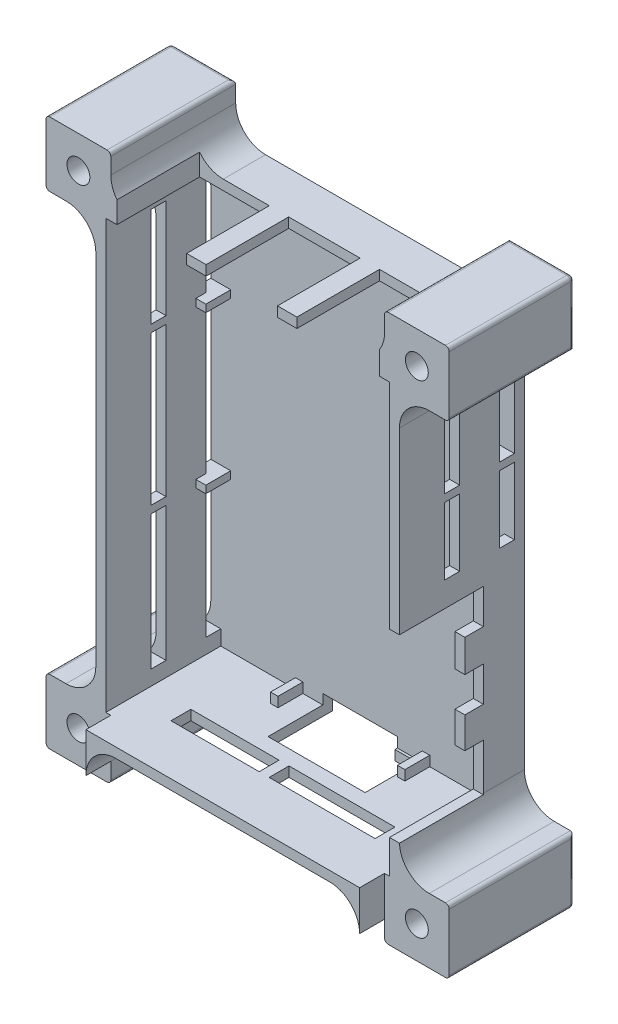
from build123d import *

# Parameters (mm, degrees)
SKETCH1_W            = 61
SKETCH1_H            = 90
BOSS_EXTRUDE1_DEPTH  = 2
SKETCH2_W            = 61
SKETCH2_H            = 90
SKETCH2_W_2          = 57
SKETCH2_H_2          = 86
BOSS_EXTRUDE2_DEPTH  = 6.6
SKETCH3_W            = 1.5
SKETCH3_H            = 2
SKETCH3_W_2          = 2
SKETCH3_H_2          = 1.5
BOSS_EXTRUDE3_DEPTH  = 5
SKETCH4_W            = 61
SKETCH4_H            = 90
SKETCH4_W_2          = 57
SKETCH4_H_2          = 86
BOSS_EXTRUDE4_DEPTH  = 16.5
SKETCH5_W            = 14.35
SKETCH5_H            = 16.6
SKETCH5_W_2          = 14
CUT_EXTRUDE1_DEPTH   = 2
SKETCH7_W            = 3
SKETCH7_H            = 35
SKETCH7_H_2          = 13.5
SKETCH7_H_3          = 20
CUT_EXTRUDE2_DEPTH   = 2
SKETCH8_W            = 19.5
SKETCH8_H            = 10.5
SKETCH8_W_2          = 17.719958389
SKETCH8_H_2          = 4
SKETCH8_W_3          = 21.280041611
CUT_EXTRUDE3_DEPTH   = 2
SKETCH9_W            = 3
SKETCH9_H            = 80
SKETCH9_H_2          = 20
SKETCH9_H_3          = 30
SKETCH9_H_4          = 27
CUT_EXTRUDE4_DEPTH   = 2
SKETCH10_W           = 61
SKETCH10_H           = 2
BOSS_EXTRUDE5_DEPTH  = 5
SKETCH12_W           = 3
SKETCH12_H           = 1.5
BOSS_EXTRUDE6_DEPTH  = 2
SKETCH13_W           = 3
SKETCH13_H           = 1.5
BOSS_EXTRUDE7_DEPTH  = 2
SKETCH20_W           = 13
SKETCH20_H           = 13
BOSS_EXTRUDE8_DEPTH  = 25.1
SKETCH25_W           = 13
SKETCH25_H           = 13
SKETCH25_W_2         = 0.25
CUT_EXTRUDE11_DEPTH  = 126.183904716
SKETCH26_W           = 1
SKETCH26_H           = 1
CUT_EXTRUDE12_DEPTH  = 23.1
SKETCH27_R           = 2.3
CUT_EXTRUDE13_DEPTH  = 126.183904716
CUT_EXTRUDE17_DEPTH  = 6
FILLET3_R            = 6
FILLET4_R            = 6
SKETCH33_W           = 0.250000008
SKETCH33_H           = 2
BOSS_EXTRUDE10_DEPTH = 5
FILLET7_R            = 6
FILLET8_R            = 6
BOSS_EXTRUDE11_DEPTH = 25.1
SKETCH35_R           = 2.3
CUT_EXTRUDE18_DEPTH  = 126.183904716
FILLET9_R            = 6
FILLET10_R           = 6
FILLET11_R           = 6
FILLET13_R           = 0.75
CUT_EXTRUDE19_DEPTH  = 6
SKETCH38_W           = 11
SKETCH38_H           = 11
CUT_EXTRUDE20_DEPTH  = 10
FILLET14_R           = 6
SKETCH39_W           = 15
SKETCH39_H           = 2.5
CUT_EXTRUDE21_DEPTH  = 4


with BuildPart() as part:
    # Sketch1 → Boss-Extrude1 (new body)
    with BuildSketch(Plane.XY):
        with Locations((30.5, 45)):
            Rectangle(SKETCH1_W, SKETCH1_H)
    extrude(amount=BOSS_EXTRUDE1_DEPTH)

    # Sketch2 → Boss-Extrude2 (add)
    with BuildSketch(Plane.XY.offset(2)):
        with Locations((30.5, 45)):
            Rectangle(SKETCH2_W, SKETCH2_H)
        with Locations((30.5, 45)):
            Rectangle(SKETCH2_W_2, SKETCH2_H_2, mode=Mode.SUBTRACT)
    extrude(amount=BOSS_EXTRUDE2_DEPTH)

    # Sketch3 → Boss-Extrude3 (add)
    with BuildSketch(Plane.XY.offset(2)):
        with Locations((43.25, 3)):
            Rectangle(SKETCH3_W, SKETCH3_H)
        with Locations((17.75, 3)):
            Rectangle(SKETCH3_W, SKETCH3_H)
        with Locations((3, 32.75)):
            Rectangle(SKETCH3_W_2, SKETCH3_H_2)
        with Locations((58, 32.75)):
            Rectangle(SKETCH3_W_2, SKETCH3_H_2)
        with Locations((58, 64.25)):
            Rectangle(SKETCH3_W_2, SKETCH3_H_2)
        with Locations((3, 64.25)):
            Rectangle(SKETCH3_W_2, SKETCH3_H_2)
    extrude(amount=BOSS_EXTRUDE3_DEPTH)

    # Sketch4 → Boss-Extrude4 (add)
    with BuildSketch(Plane.XY.offset(8.6)):
        with Locations((30.5, 45)):
            Rectangle(SKETCH4_W, SKETCH4_H)
        with Locations((30.5, 45)):
            Rectangle(SKETCH4_W_2, SKETCH4_H_2, mode=Mode.SUBTRACT)
    extrude(amount=BOSS_EXTRUDE4_DEPTH)

    # Sketch5 → Cut-Extrude1 (cut)
    with BuildSketch(Plane(origin=(0, 90, 0), x_dir=(1, 0, 0), z_dir=(0, 1, 0))):
        Polygon((57, -8.5), (40.4, -8.5), (40.4, -22.25), (40.4, -25.1), (57, -25.1), align=None)
        with Locations((29.325, -16.8)):
            Rectangle(SKETCH5_W, SKETCH5_H)
        with Locations((11.25, -16.8)):
            Rectangle(SKETCH5_W_2, SKETCH5_H)
    extrude(amount=-CUT_EXTRUDE1_DEPTH, mode=Mode.SUBTRACT)

    # Sketch7 → Cut-Extrude2 (cut)
    with BuildSketch(Plane(origin=(61, 0, 0), x_dir=(0, 0, -1), z_dir=(1, 0, 0))):
        Polygon((-11.95, 18.25), (-11.95, 24.5), (-8.25, 24.5), (-8.25, 31.5), (-11.95, 31.5), (-11.95, 38), (-8.25, 38), (-8.25, 45), (-25.1, 45), (-25.1, 8.75), (-8.25, 8.75), (-8.25, 18.25), align=None)
        with Locations((-3.5, 67.5)):
            Rectangle(SKETCH7_W, SKETCH7_H)
        with Locations((-14.5, 56.75)):
            Rectangle(SKETCH7_W, SKETCH7_H_2)
        with Locations((-14.5, 75)):
            Rectangle(SKETCH7_W, SKETCH7_H_3)
    extrude(amount=-CUT_EXTRUDE2_DEPTH, mode=Mode.SUBTRACT)

    # Sketch8 → Cut-Extrude3 (cut)
    with BuildSketch(Plane(origin=(0, 0, 0), x_dir=(-1, 0, 0), z_dir=(0, -1, 0))):
        with Locations((-32.25, -7.75)):
            Rectangle(SKETCH8_W, SKETCH8_H)
        with Locations((-18.859979194, -18)):
            Rectangle(SKETCH8_W_2, SKETCH8_H_2)
        with Locations((-40.359979194, -18)):
            Rectangle(SKETCH8_W_3, SKETCH8_H_2)
    extrude(amount=-CUT_EXTRUDE3_DEPTH, mode=Mode.SUBTRACT)

    # Sketch9 → Cut-Extrude4 (cut)
    with BuildSketch(Plane.ZY):
        with Locations((3.5, 45)):
            Rectangle(SKETCH9_W, SKETCH9_H)
        with Locations((14.5, 75)):
            Rectangle(SKETCH9_W, SKETCH9_H_2)
        with Locations((14.5, 48.5)):
            Rectangle(SKETCH9_W, SKETCH9_H_3)
        with Locations((14.5, 18.5)):
            Rectangle(SKETCH9_W, SKETCH9_H_4)
    extrude(amount=-CUT_EXTRUDE4_DEPTH, mode=Mode.SUBTRACT)

    # Sketch10 → Boss-Extrude5 (add)
    with BuildSketch(Plane.XY.offset(25.1)):
        with Locations((30.5, 1)):
            Rectangle(SKETCH10_W, SKETCH10_H)
    extrude(amount=BOSS_EXTRUDE5_DEPTH)

    # Sketch12 → Boss-Extrude6 (add)
    with BuildSketch(Plane.ZY.offset(-2)):
        with Locations((3.5, 64.25)):
            Rectangle(SKETCH12_W, SKETCH12_H)
        with Locations((3.5, 32.75)):
            Rectangle(SKETCH12_W, SKETCH12_H)
    extrude(amount=BOSS_EXTRUDE6_DEPTH)

    # Sketch13 → Boss-Extrude7 (add)
    with BuildSketch(Plane(origin=(59, 0, 0), x_dir=(0, 0, -1), z_dir=(1, 0, 0))):
        with Locations((-3.5, 64.25)):
            Rectangle(SKETCH13_W, SKETCH13_H)
    extrude(amount=BOSS_EXTRUDE7_DEPTH)

    # Sketch20 → Boss-Extrude8 (add)
    with BuildSketch(Plane(origin=(0, 0, 0), x_dir=(-1, 0, 0), z_dir=(0, 0, -1))):
        with Locations((3.5, -3.5)):
            Rectangle(SKETCH20_W, SKETCH20_H)
        with Locations((-64.5, 93.5)):
            Rectangle(SKETCH20_W, SKETCH20_H)
    extrude(amount=-BOSS_EXTRUDE8_DEPTH)

    # Sketch25 → Cut-Extrude11 (cut, through all)
    with BuildSketch(Plane.XY.offset(25.1)):
        with Locations((-3.5, -3.5)):
            Rectangle(SKETCH25_W, SKETCH25_H)
        with Locations((3.125, -3.5)):
            Rectangle(SKETCH25_W_2, SKETCH25_H)
    extrude(amount=CUT_EXTRUDE11_DEPTH, mode=Mode.SUBTRACT)

    # Sketch26 → Cut-Extrude12 (cut)
    with BuildSketch(Plane.XY.offset(25.1)):
        with Locations((2.5, 2.5)):
            Rectangle(SKETCH26_W, SKETCH26_H)
        with Locations((58.5, 87.5)):
            Rectangle(SKETCH26_W, SKETCH26_H)
    extrude(amount=-CUT_EXTRUDE12_DEPTH, mode=Mode.SUBTRACT)

    # Sketch27 → Cut-Extrude13 (cut, through all)
    with BuildSketch(Plane.XY.offset(25.1)):
        with Locations((-3.5, -3.5)):
            Circle(SKETCH27_R)
        with Locations((64.5, 93.5)):
            Circle(SKETCH27_R)
    extrude(amount=-CUT_EXTRUDE13_DEPTH, mode=Mode.SUBTRACT)

    # Sketch31 → Cut-Extrude17 (cut)
    with BuildSketch(Plane(origin=(0, 0, 0), x_dir=(-1, 0, 0), z_dir=(0, 0, -1))):
        Polygon((-61.873056275, 88.95), (-59.24611255, 93.5), (-61.873056275, 98.05), (-67.126943725, 98.05), (-69.75388745, 93.5), (-67.126943725, 88.95), align=None)
        Polygon((6.126943725, -8.05), (8.75388745, -3.5), (6.126943725, 1.05), (0.873056275, 1.05), (-1.75388745, -3.5), (0.873056275, -8.05), align=None)
    extrude(amount=-CUT_EXTRUDE17_DEPTH, mode=Mode.SUBTRACT)

    # Fillet3
    fillet3_edges = [part.edges().sort_by_distance(p)[0] for p in [
        (58, 90, 12.55),
    ]]
    fillet(fillet3_edges, radius=FILLET3_R)

    # Fillet4
    # the kernel refuses this fillet: 6 mm, written as the material it adds along each edge
    with BuildSketch(Plane(origin=(61, 87, 25.1), x_dir=(1, 0, 0), z_dir=(0, 0, -1))) as fillet4_piece_1_section:
        with BuildLine():
            CenterArc((FILLET4_R, FILLET4_R), FILLET4_R, 180, 90)
            Line((0, FILLET4_R), (0, 0))
            Line((0, 0), (FILLET4_R, 0))
        make_face()
    fillet4_piece_1 = extrude(amount=25.1, mode=Mode.PRIVATE)
    fillet4_piece_1 = split(fillet4_piece_1, bisect_by=Plane(origin=(62.635972967, 85, 20.55), z_dir=(0, 1, 0)), keep=Keep.TOP, mode=Mode.PRIVATE)
    add(fillet4_piece_1)
    with BuildSketch(Plane(origin=(61, 87, 25.1), x_dir=(1, 0, 0), z_dir=(0, 0, -1))) as fillet4_piece_2_section:
        with BuildLine():
            CenterArc((FILLET4_R, FILLET4_R), FILLET4_R, 180, 90)
            Line((0, FILLET4_R), (0, 0))
            Line((0, 0), (FILLET4_R, 0))
        make_face()
    fillet4_piece_2 = extrude(amount=40.1, mode=Mode.PRIVATE)
    fillet4_piece_2 = split(fillet4_piece_2, bisect_by=Plane(origin=(61.446267567, 84.027256087, 16), z_dir=(0, 0, 1)), keep=Keep.TOP, mode=Mode.PRIVATE)
    add(fillet4_piece_2)
    with BuildSketch(Plane(origin=(61, 87, 40.1), x_dir=(1, 0, 0), z_dir=(0, 0, -1))) as fillet4_piece_3_section:
        with BuildLine():
            CenterArc((FILLET4_R, FILLET4_R), FILLET4_R, 180, 90)
            Line((0, FILLET4_R), (0, 0))
            Line((0, 0), (FILLET4_R, 0))
        make_face()
    fillet4_piece_3 = extrude(amount=55.1, mode=Mode.PRIVATE)
    fillet4_piece_3 = split(fillet4_piece_3, bisect_by=Plane(origin=(61.446267567, 84.027256087, 13), z_dir=(0, 0, -1)), keep=Keep.TOP, mode=Mode.PRIVATE)
    fillet4_piece_3 = split(fillet4_piece_3, bisect_by=Plane(origin=(61.446267567, 84.027256087, 5), z_dir=(0, 0, 1)), keep=Keep.TOP, mode=Mode.PRIVATE)
    add(fillet4_piece_3)
    with BuildSketch(Plane(origin=(61, 87, 40.1), x_dir=(1, 0, 0), z_dir=(0, 0, -1))) as fillet4_piece_4_section:
        with BuildLine():
            CenterArc((FILLET4_R, FILLET4_R), FILLET4_R, 180, 90)
            Line((0, FILLET4_R), (0, 0))
            Line((0, 0), (FILLET4_R, 0))
        make_face()
    fillet4_piece_4 = extrude(amount=40.1, mode=Mode.PRIVATE)
    fillet4_piece_4 = split(fillet4_piece_4, bisect_by=Plane(origin=(61.446267567, 84.027256087, 2), z_dir=(0, 0, -1)), keep=Keep.TOP, mode=Mode.PRIVATE)
    add(fillet4_piece_4)

    # Sketch33 → Boss-Extrude10 (add)
    with BuildSketch(Plane.XY.offset(25.1)):
        with Locations((3.124999996, 1)):
            Rectangle(SKETCH33_W, SKETCH33_H)
    extrude(amount=BOSS_EXTRUDE10_DEPTH)

    # Fillet7
    # the kernel refuses this fillet: 6 mm, written as the material it adds along each edge
    with BuildSketch(Plane(origin=(3, 0, 0), x_dir=(1, 0, 0), z_dir=(0, 0, 1))) as fillet7_piece_1_section:
        with BuildLine():
            CenterArc((FILLET7_R, -FILLET7_R), FILLET7_R, 90, 90)
            Line((0, -FILLET7_R), (0, 0))
            Line((0, 0), (FILLET7_R, 0))
        make_face()
    fillet7_piece_1 = extrude(amount=25.1, mode=Mode.PRIVATE)
    fillet7_piece_1 = split(fillet7_piece_1, bisect_by=Plane(origin=(2.999999992, -1.220838783, 12.55), z_dir=(1, 0, 0)), keep=Keep.TOP, mode=Mode.PRIVATE)
    add(fillet7_piece_1)
    with BuildSketch(Plane(origin=(3, 0, 0), x_dir=(1, 0, 0), z_dir=(0, 0, 1))) as fillet7_piece_2_section:
        with BuildLine():
            CenterArc((FILLET7_R, -FILLET7_R), FILLET7_R, 90, 90)
            Line((0, -FILLET7_R), (0, 0))
            Line((0, 0), (FILLET7_R, 0))
        make_face()
    fillet7_piece_2 = extrude(amount=40.1, mode=Mode.PRIVATE)
    fillet7_piece_2 = split(fillet7_piece_2, bisect_by=Plane(origin=(4.481706294, -1.220838783, 25.1), z_dir=(0, 0, 1)), keep=Keep.TOP, mode=Mode.PRIVATE)
    fillet7_piece_2 = split(fillet7_piece_2, bisect_by=Plane(origin=(2.999999992, -1.220838783, 27.6), z_dir=(1, 0, 0)), keep=Keep.TOP, mode=Mode.PRIVATE)
    fillet7_piece_2 = split(fillet7_piece_2, bisect_by=Plane(origin=(4.481706294, -1.220838783, 30.1), z_dir=(0, 0, -1)), keep=Keep.TOP, mode=Mode.PRIVATE)
    add(fillet7_piece_2)

    # Fillet8
    # the kernel refuses this fillet: 6 mm, written as the material it adds along each edge
    with BuildSketch(Plane(origin=(0, 3, 25.1), x_dir=(0, 1, 0), z_dir=(0, 0, -1))) as fillet8_piece_1_section:
        with BuildLine():
            CenterArc((FILLET8_R, -FILLET8_R), FILLET8_R, 90, 90)
            Line((0, -FILLET8_R), (0, 0))
            Line((0, 0), (FILLET8_R, 0))
        make_face()
    fillet8_piece_1 = extrude(amount=40.1, mode=Mode.PRIVATE)
    fillet8_piece_1 = split(fillet8_piece_1, bisect_by=Plane(origin=(-0.446267567, 5.972743913, 16), z_dir=(0, 0, 1)), keep=Keep.TOP, mode=Mode.PRIVATE)
    add(fillet8_piece_1)
    with BuildSketch(Plane(origin=(0, 3, 25.1), x_dir=(0, 1, 0), z_dir=(0, 0, -1))) as fillet8_piece_2_section:
        with BuildLine():
            CenterArc((FILLET8_R, -FILLET8_R), FILLET8_R, 90, 90)
            Line((0, -FILLET8_R), (0, 0))
            Line((0, 0), (FILLET8_R, 0))
        make_face()
    fillet8_piece_2 = extrude(amount=25.1, mode=Mode.PRIVATE)
    fillet8_piece_2 = split(fillet8_piece_2, bisect_by=Plane(origin=(-1.635972967, 5, 14.5), z_dir=(0, -1, 0)), keep=Keep.TOP, mode=Mode.PRIVATE)
    add(fillet8_piece_2)
    with BuildSketch(Plane(origin=(0, 3, 40.1), x_dir=(0, 1, 0), z_dir=(0, 0, -1))) as fillet8_piece_3_section:
        with BuildLine():
            CenterArc((FILLET8_R, -FILLET8_R), FILLET8_R, 90, 90)
            Line((0, -FILLET8_R), (0, 0))
            Line((0, 0), (FILLET8_R, 0))
        make_face()
    fillet8_piece_3 = extrude(amount=55.1, mode=Mode.PRIVATE)
    fillet8_piece_3 = split(fillet8_piece_3, bisect_by=Plane(origin=(-0.446267567, 5.972743913, 13), z_dir=(0, 0, -1)), keep=Keep.TOP, mode=Mode.PRIVATE)
    fillet8_piece_3 = split(fillet8_piece_3, bisect_by=Plane(origin=(-0.446267567, 5.972743913, 5), z_dir=(0, 0, 1)), keep=Keep.TOP, mode=Mode.PRIVATE)
    add(fillet8_piece_3)
    with BuildSketch(Plane(origin=(0, 3, 40.1), x_dir=(0, 1, 0), z_dir=(0, 0, -1))) as fillet8_piece_4_section:
        with BuildLine():
            CenterArc((FILLET8_R, -FILLET8_R), FILLET8_R, 90, 90)
            Line((0, -FILLET8_R), (0, 0))
            Line((0, 0), (FILLET8_R, 0))
        make_face()
    fillet8_piece_4 = extrude(amount=40.1, mode=Mode.PRIVATE)
    fillet8_piece_4 = split(fillet8_piece_4, bisect_by=Plane(origin=(-0.446267567, 5.972743913, 2), z_dir=(0, 0, -1)), keep=Keep.TOP, mode=Mode.PRIVATE)
    add(fillet8_piece_4)

    # Sketch34 → Boss-Extrude11 (add)
    with BuildSketch(Plane.XY.offset(25.1)):
        Polygon((59, 3), (71, 3), (71, -10), (58, -10), (58, 2), (59, 2), align=None)
        Polygon((2, 87), (-10, 87), (-10, 100), (3, 100), (3, 88), (2, 88), align=None)
    extrude(amount=-BOSS_EXTRUDE11_DEPTH)

    # Sketch35 → Cut-Extrude18 (cut, through all)
    with BuildSketch(Plane.XY.offset(25.1)):
        with Locations((-3.5, 93.5)):
            Circle(SKETCH35_R)
        with Locations((64.5, -3.5)):
            Circle(SKETCH35_R)
    extrude(amount=-CUT_EXTRUDE18_DEPTH, mode=Mode.SUBTRACT)

    # Fillet9
    # the kernel refuses this fillet: 6 mm, written as the material it adds along each edge
    with BuildSketch(Plane(origin=(0, 87, 0), x_dir=(0, -1, 0), z_dir=(0, 0, 1))) as fillet9_piece_1_section:
        with BuildLine():
            CenterArc((FILLET9_R, -FILLET9_R), FILLET9_R, 90, 90)
            Line((0, -FILLET9_R), (0, 0))
            Line((0, 0), (FILLET9_R, 0))
        make_face()
    fillet9_piece_1 = extrude(amount=40.1, mode=Mode.PRIVATE)
    fillet9_piece_1 = split(fillet9_piece_1, bisect_by=Plane(origin=(-0.446267567, 84.027256087, 2), z_dir=(0, 0, -1)), keep=Keep.TOP, mode=Mode.PRIVATE)
    add(fillet9_piece_1)
    with BuildSketch(Plane(origin=(0, 87, 0), x_dir=(0, -1, 0), z_dir=(0, 0, 1))) as fillet9_piece_2_section:
        with BuildLine():
            CenterArc((FILLET9_R, -FILLET9_R), FILLET9_R, 90, 90)
            Line((0, -FILLET9_R), (0, 0))
            Line((0, 0), (FILLET9_R, 0))
        make_face()
    fillet9_piece_2 = extrude(amount=25.1, mode=Mode.PRIVATE)
    fillet9_piece_2 = split(fillet9_piece_2, bisect_by=Plane(origin=(-1.635972967, 85, 3.5), z_dir=(0, 1, 0)), keep=Keep.TOP, mode=Mode.PRIVATE)
    add(fillet9_piece_2)
    with BuildSketch(Plane(origin=(0, 87, -15), x_dir=(0, -1, 0), z_dir=(0, 0, 1))) as fillet9_piece_3_section:
        with BuildLine():
            CenterArc((FILLET9_R, -FILLET9_R), FILLET9_R, 90, 90)
            Line((0, -FILLET9_R), (0, 0))
            Line((0, 0), (FILLET9_R, 0))
        make_face()
    fillet9_piece_3 = extrude(amount=55.1, mode=Mode.PRIVATE)
    fillet9_piece_3 = split(fillet9_piece_3, bisect_by=Plane(origin=(-0.446267567, 84.027256087, 13), z_dir=(0, 0, -1)), keep=Keep.TOP, mode=Mode.PRIVATE)
    fillet9_piece_3 = split(fillet9_piece_3, bisect_by=Plane(origin=(-0.446267567, 84.027256087, 5), z_dir=(0, 0, 1)), keep=Keep.TOP, mode=Mode.PRIVATE)
    add(fillet9_piece_3)
    with BuildSketch(Plane(origin=(0, 87, -15), x_dir=(0, -1, 0), z_dir=(0, 0, 1))) as fillet9_piece_4_section:
        with BuildLine():
            CenterArc((FILLET9_R, -FILLET9_R), FILLET9_R, 90, 90)
            Line((0, -FILLET9_R), (0, 0))
            Line((0, 0), (FILLET9_R, 0))
        make_face()
    fillet9_piece_4 = extrude(amount=40.1, mode=Mode.PRIVATE)
    fillet9_piece_4 = split(fillet9_piece_4, bisect_by=Plane(origin=(-0.446267567, 84.027256087, 16), z_dir=(0, 0, 1)), keep=Keep.TOP, mode=Mode.PRIVATE)
    add(fillet9_piece_4)

    # Fillet10
    fillet10_edges = [part.edges().sort_by_distance(p)[0] for p in [
        (3, 90, 12.55),
    ]]
    fillet(fillet10_edges, radius=FILLET10_R)

    # Fillet11
    fillet11_edges = [part.edges().sort_by_distance(p)[0] for p in [
        (61, 3, 12.55),
    ]]
    fillet(fillet11_edges, radius=FILLET11_R)

    # Fillet13
    fillet13_edges = [part.edges().sort_by_distance(p)[0] for p in [
        (3, -10, 12.55),
        (-3.5, -10, 0),
        (-10, -3.5, 0),
        (-10, -10, 12.55),
        (-10, 3, 12.55),
        (58, 100, 12.55),
        (64.5, 100, 0),
        (71, 93.5, 0),
        (71, 100, 12.55),
        (71, 87, 12.55),
        (58, -10, 12.55),
        (64.5, -10, 0),
        (71, -10, 12.55),
        (71, -3.5, 0),
        (71, 3, 12.55),
        (3, 100, 12.55),
        (-3.5, 100, 0),
        (-10, 100, 12.55),
        (-10, 93.5, 0),
        (-10, 87, 12.55),
    ]]
    fillet(fillet13_edges, radius=FILLET13_R)

    # Sketch36 → Cut-Extrude19 (cut)
    with BuildSketch(Plane(origin=(0, 0, 0), x_dir=(-1, 0, 0), z_dir=(0, 0, -1))):
        Polygon((-59.24611255, -3.5), (-61.873056275, 1.05), (-67.126943725, 1.05), (-69.75388745, -3.5), (-67.126943725, -8.05), (-61.873056275, -8.05), align=None)
        Polygon((-1.75388745, 93.5), (0.873056275, 88.95), (6.126943725, 88.95), (8.75388745, 93.5), (6.126943725, 98.05), (0.873056275, 98.05), align=None)
    extrude(amount=-CUT_EXTRUDE19_DEPTH, mode=Mode.SUBTRACT)

    # Sketch38 → Cut-Extrude20 (cut)
    with BuildSketch(Plane.XY.offset(25.1)):
        with Locations((63.5, -2.5)):
            Rectangle(SKETCH38_W, SKETCH38_H)
    extrude(amount=CUT_EXTRUDE20_DEPTH, mode=Mode.SUBTRACT)

    # Fillet14
    # the kernel refuses this fillet: 6 mm, written as the material it adds along each edge
    with BuildSketch(Plane(origin=(58, 0, 40.1), x_dir=(-1, 0, 0), z_dir=(0, 0, -1))) as fillet14_piece_1_section:
        with BuildLine():
            CenterArc((FILLET14_R, -FILLET14_R), FILLET14_R, 90, 90)
            Line((0, -FILLET14_R), (0, 0))
            Line((0, 0), (FILLET14_R, 0))
        make_face()
    fillet14_piece_1 = extrude(amount=40.1, mode=Mode.PRIVATE)
    fillet14_piece_1 = split(fillet14_piece_1, bisect_by=Plane(origin=(56.518293699, -1.220838778, 30.1), z_dir=(0, 0, -1)), keep=Keep.TOP, mode=Mode.PRIVATE)
    fillet14_piece_1 = split(fillet14_piece_1, bisect_by=Plane(origin=(58, -1.220838778, 27.6), z_dir=(-1, 0, 0)), keep=Keep.TOP, mode=Mode.PRIVATE)
    fillet14_piece_1 = split(fillet14_piece_1, bisect_by=Plane(origin=(56.518293699, -1.220838778, 25.1), z_dir=(0, 0, 1)), keep=Keep.TOP, mode=Mode.PRIVATE)
    add(fillet14_piece_1)
    with BuildSketch(Plane(origin=(58, 0, 25.1), x_dir=(-1, 0, 0), z_dir=(0, 0, -1))) as fillet14_piece_2_section:
        with BuildLine():
            CenterArc((FILLET14_R, -FILLET14_R), FILLET14_R, 90, 90)
            Line((0, -FILLET14_R), (0, 0))
            Line((0, 0), (FILLET14_R, 0))
        make_face()
    fillet14_piece_2 = extrude(amount=25.1, mode=Mode.PRIVATE)
    fillet14_piece_2 = split(fillet14_piece_2, bisect_by=Plane(origin=(58, -1.220838778, 12.55), z_dir=(-1, 0, 0)), keep=Keep.TOP, mode=Mode.PRIVATE)
    add(fillet14_piece_2)

    # Sketch39 → Cut-Extrude21 (cut)
    with BuildSketch(Plane.XZ):
        with Locations((30, 1.25)):
            Rectangle(SKETCH39_W, SKETCH39_H)
    extrude(amount=-CUT_EXTRUDE21_DEPTH, mode=Mode.SUBTRACT)


solid = part.part
